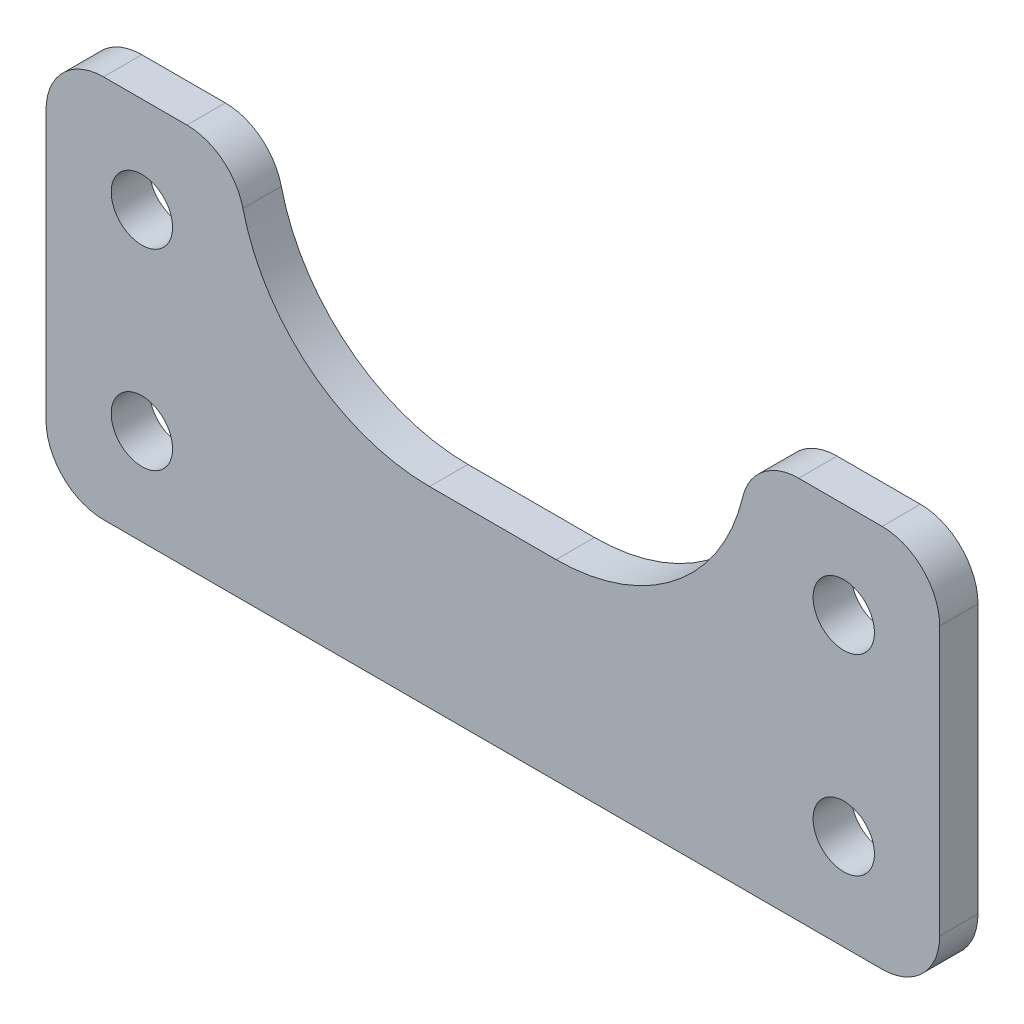
from build123d import *

# Parameters (mm, degrees)
SKETCH_1_R      = 1.6
EXTRUDE_1_DEPTH = 2
FILLET_1_R      = 10
FILLET_2_R      = 3


with BuildPart() as part:
    # ｽｹｯﾁ1 → ﾎﾞｽ - 押し出し1 (new body)
    with BuildSketch(Plane.XY):
        Polygon((0, 20), (0, 0), (46.6, 0), (46.6, 20), (36.6, 20), (36.6, 10), (10, 10), (10, 20), align=None)
        with Locations((5, 5)):
            Circle(SKETCH_1_R, mode=Mode.SUBTRACT)
        with Locations((41.6, 5)):
            Circle(SKETCH_1_R, mode=Mode.SUBTRACT)
        with Locations((5, 15)):
            Circle(SKETCH_1_R, mode=Mode.SUBTRACT)
        with Locations((41.6, 15)):
            Circle(SKETCH_1_R, mode=Mode.SUBTRACT)
    extrude(amount=EXTRUDE_1_DEPTH)

    # ﾌｨﾚｯﾄ1
    fillet_1_edges = [part.edges().sort_by_distance(p)[0] for p in [
        (36.6, 10, 1),
        (10, 10, 1),
    ]]
    fillet(fillet_1_edges, radius=FILLET_1_R - 0.0001)  # a hair under: the kernel refuses the full size

    # ﾌｨﾚｯﾄ2
    fillet_2_edges = [part.edges().sort_by_distance(p)[0] for p in [
        (46.6, 20, 1),
        (46.6, 0, 1),
        (0, 0, 1),
        (0, 20, 1),
        (10, 20, 1),
        (36.6, 20, 1),
    ]]
    fillet(fillet_2_edges, radius=FILLET_2_R)


solid = part.part
